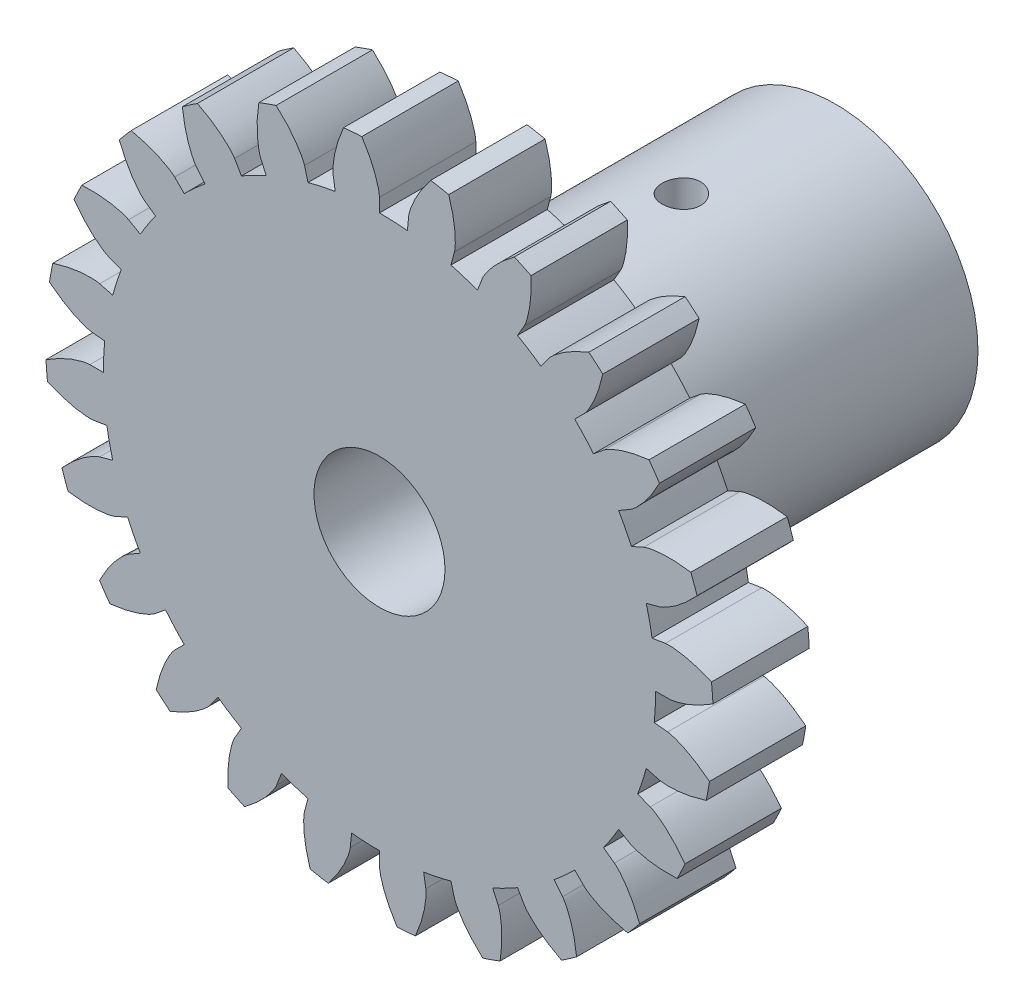
from build123d import *
from build123d.topology import SkipClean

# Parameters (mm, degrees)
SKETCH_3_R               = 26
EXTRUDE_2_DEPTH          = 7.5
CUT_EXTRUDE_2_DEPTH      = 38.526657192
PATTERN_CIRCULAR_1_COUNT = 24
MIRROR_1_COPY_1_DEPTH    = 38.526657192
MIRROR_1_COPY_2_DEPTH    = 38.526657192
MIRROR_1_COPY_3_DEPTH    = 38.526657192
MIRROR_1_COPY_4_DEPTH    = 38.526657192
MIRROR_1_COPY_5_DEPTH    = 38.526657192
MIRROR_1_COPY_6_DEPTH    = 38.526657192
MIRROR_1_COPY_7_DEPTH    = 38.526657192
MIRROR_1_COPY_8_DEPTH    = 38.526657192
MIRROR_1_COPY_9_DEPTH    = 38.526657192
MIRROR_1_COPY_10_DEPTH   = 38.526657192
MIRROR_1_COPY_11_DEPTH   = 38.526657192
MIRROR_1_COPY_12_DEPTH   = 38.526657192
MIRROR_1_COPY_13_DEPTH   = 38.526657192
MIRROR_1_COPY_14_DEPTH   = 38.526657192
MIRROR_1_COPY_15_DEPTH   = 38.526657192
MIRROR_1_COPY_16_DEPTH   = 38.526657192
MIRROR_1_COPY_17_DEPTH   = 38.526657192
MIRROR_1_COPY_18_DEPTH   = 38.526657192
MIRROR_1_COPY_19_DEPTH   = 38.526657192
MIRROR_1_COPY_20_DEPTH   = 38.526657192
MIRROR_1_COPY_21_DEPTH   = 38.526657192
MIRROR_1_COPY_22_DEPTH   = 38.526657192
MIRROR_1_COPY_23_DEPTH   = 38.526657192
MIRROR_1_COPY_24_DEPTH   = 38.526657192
SKETCH_5_R               = 5.1
CUT_EXTRUDE_3_DEPTH      = 38.476388038
SKETCH_7_R               = 11.1
SKETCH_7_R_2             = 5.1
EXTRUDE_3_DEPTH          = 28
CUT_EXTRUDE_4_DEPTH      = 47.176072363
CUT_EXTRUDE_4_DEPTH_BACK = 47.176072363
SKETCH_8_R               = 1.5


with BuildPart() as part:
    # ｽｹｯﾁ3 → ﾎﾞｽ - 押し出し2 (new body)
    with BuildSketch(Plane.XY):
        Circle(SKETCH_3_R)
    extrude(amount=EXTRUDE_2_DEPTH)

    # ｽｹｯﾁ4 → ｶｯﾄ - 押し出し2 (cut, through all)
    with BuildSketch(Plane.XY):
        with BuildLine():
            Line((21.472541613, -1.086258116), (25.966794508, -1.313614466))
            ThreePointArc((25.966794508, -1.313614466), (25.99998299, 0.029741003), (25.963721309, 1.373017029))
            add(Edge.make_bspline(
                [(22.552622899, 0), (22.58737922, 0.001108669), (22.656749084, 0.005403897), (22.850516265, 0.028314483), (23.215577821, 0.099947013), (23.763996392, 0.257632086), (24.493326716, 0.545763948), (25.148201555, 0.876714847), (25.627692166, 1.158881091), (25.900535651, 1.332190349), (25.963721309, 1.373017029)],
                knots=[0, 0, 0, 0, 0, 0.002802036, 0.005604071, 0.015718253, 0.029959921, 0.048733673, 0.068727069, 0.074791923, 0.074791923, 0.074791923, 0.074791923, 0.074791923], degree=4))
            Line((22.552622899, 0), (21.5, 0))
            ThreePointArc((21.5, 0), (21.493134307, -0.543302553), (21.472541613, -1.086258116))
        make_face()
    cut_extrude_2 = extrude(amount=CUT_EXTRUDE_2_DEPTH, mode=Mode.SUBTRACT)

    # 円形ﾊﾟﾀｰﾝ1: ｶｯﾄ - 押し出し2 ×24 about axis
    pattern_circular_1_axis = Axis((0, 0, 7.5), (0, 0, -1))
    for i in range(1, PATTERN_CIRCULAR_1_COUNT):
        add(cut_extrude_2.rotate(pattern_circular_1_axis, i * 360 / PATTERN_CIRCULAR_1_COUNT), mode=Mode.SUBTRACT)

    # ﾐﾗｰ1 copy 1 sketch → ﾐﾗｰ1 copy 1 (cut, through all)
    with BuildSketch(Plane(origin=(0, 0, 0), x_dir=(0.9871140654944314, 0.1600181917878578, 0), z_dir=(0, 0, 1))):
        with BuildLine():
            Line((21.472541613, 1.086258116), (25.966794508, 1.313614466))
            ThreePointArc((25.966794508, 1.313614466), (25.99998299, -0.029741003), (25.963721309, -1.373017029))
            add(Edge.make_bspline(
                [(22.552622899, 0), (22.58737922, -0.001108669), (22.656749084, -0.005403897), (22.850516265, -0.028314483), (23.215577821, -0.099947013), (23.763996392, -0.257632086), (24.493326716, -0.545763948), (25.148201555, -0.876714847), (25.627692166, -1.158881091), (25.900535651, -1.332190349), (25.963721309, -1.373017029)],
                knots=[0, 0, 0, 0, 0, 0.002802036, 0.005604071, 0.015718253, 0.029959921, 0.048733673, 0.068727069, 0.074791923, 0.074791923, 0.074791923, 0.074791923, 0.074791923], degree=4))
            Line((22.552622899, 0), (21.5, 0))
            ThreePointArc((21.5, 0), (21.493134307, 0.543302553), (21.472541613, 1.086258116))
        make_face()
    extrude(amount=MIRROR_1_COPY_1_DEPTH, mode=Mode.SUBTRACT)

    # ﾐﾗｰ1 copy 2 sketch → ﾐﾗｰ1 copy 2 (cut, through all)
    with BuildSketch(Plane(origin=(0, 0, 0), x_dir=(0.9120632137567047, 0.41004962396250505, 0), z_dir=(0, 0, 1))):
        with BuildLine():
            Line((21.472541613, 1.086258116), (25.966794508, 1.313614466))
            ThreePointArc((25.966794508, 1.313614466), (25.99998299, -0.029741003), (25.963721309, -1.373017029))
            add(Edge.make_bspline(
                [(22.552622899, 0), (22.58737922, -0.001108669), (22.656749084, -0.005403897), (22.850516265, -0.028314483), (23.215577821, -0.099947013), (23.763996392, -0.257632086), (24.493326716, -0.545763948), (25.148201555, -0.876714847), (25.627692166, -1.158881091), (25.900535651, -1.332190349), (25.963721309, -1.373017029)],
                knots=[0, 0, 0, 0, 0, 0.002802036, 0.005604071, 0.015718253, 0.029959921, 0.048733673, 0.068727069, 0.074791923, 0.074791923, 0.074791923, 0.074791923, 0.074791923], degree=4))
            Line((22.552622899, 0), (21.5, 0))
            ThreePointArc((21.5, 0), (21.493134307, 0.543302553), (21.472541613, 1.086258116))
        make_face()
    extrude(amount=MIRROR_1_COPY_2_DEPTH, mode=Mode.SUBTRACT)

    # ﾐﾗｰ1 copy 3 sketch → ﾐﾗｰ1 copy 3 (cut, through all)
    with BuildSketch(Plane(origin=(0, 0, 0), x_dir=(0.7748567612571848, 0.6321368519031512, 0), z_dir=(0, 0, 1))):
        with BuildLine():
            Line((21.472541613, 1.086258116), (25.966794508, 1.313614466))
            ThreePointArc((25.966794508, 1.313614466), (25.99998299, -0.029741003), (25.963721309, -1.373017029))
            add(Edge.make_bspline(
                [(22.552622899, 0), (22.58737922, -0.001108669), (22.656749084, -0.005403897), (22.850516265, -0.028314483), (23.215577821, -0.099947013), (23.763996392, -0.257632086), (24.493326716, -0.545763948), (25.148201555, -0.876714847), (25.627692166, -1.158881091), (25.900535651, -1.332190349), (25.963721309, -1.373017029)],
                knots=[0, 0, 0, 0, 0, 0.002802036, 0.005604071, 0.015718253, 0.029959921, 0.048733673, 0.068727069, 0.074791923, 0.074791923, 0.074791923, 0.074791923, 0.074791923], degree=4))
            Line((22.552622899, 0), (21.5, 0))
            ThreePointArc((21.5, 0), (21.493134307, 0.543302553), (21.472541613, 1.086258116))
        make_face()
    extrude(amount=MIRROR_1_COPY_3_DEPTH, mode=Mode.SUBTRACT)

    # ﾐﾗｰ1 copy 4 sketch → ﾐﾗｰ1 copy 4 (cut, through all)
    with BuildSketch(Plane(origin=(0, 0, 0), x_dir=(0.5848451009893306, 0.8111449980421381, 0), z_dir=(0, 0, 1))):
        with BuildLine():
            Line((21.472541613, 1.086258116), (25.966794508, 1.313614466))
            ThreePointArc((25.966794508, 1.313614466), (25.99998299, -0.029741003), (25.963721309, -1.373017029))
            add(Edge.make_bspline(
                [(22.552622899, 0), (22.58737922, -0.001108669), (22.656749084, -0.005403897), (22.850516265, -0.028314483), (23.215577821, -0.099947013), (23.763996392, -0.257632086), (24.493326716, -0.545763948), (25.148201555, -0.876714847), (25.627692166, -1.158881091), (25.900535651, -1.332190349), (25.963721309, -1.373017029)],
                knots=[0, 0, 0, 0, 0, 0.002802036, 0.005604071, 0.015718253, 0.029959921, 0.048733673, 0.068727069, 0.074791923, 0.074791923, 0.074791923, 0.074791923, 0.074791923], degree=4))
            Line((22.552622899, 0), (21.5, 0))
            ThreePointArc((21.5, 0), (21.493134307, 0.543302553), (21.472541613, 1.086258116))
        make_face()
    extrude(amount=MIRROR_1_COPY_4_DEPTH, mode=Mode.SUBTRACT)

    # ﾐﾗｰ1 copy 5 sketch → ﾐﾗｰ1 copy 5 (cut, through all)
    with BuildSketch(Plane(origin=(0, 0, 0), x_dir=(0.3549772135912804, 0.934874953045043, 0), z_dir=(0, 0, 1))):
        with BuildLine():
            Line((21.472541613, 1.086258116), (25.966794508, 1.313614466))
            ThreePointArc((25.966794508, 1.313614466), (25.99998299, -0.029741003), (25.963721309, -1.373017029))
            add(Edge.make_bspline(
                [(22.552622899, 0), (22.58737922, -0.001108669), (22.656749084, -0.005403897), (22.850516265, -0.028314483), (23.215577821, -0.099947013), (23.763996392, -0.257632086), (24.493326716, -0.545763948), (25.148201555, -0.876714847), (25.627692166, -1.158881091), (25.900535651, -1.332190349), (25.963721309, -1.373017029)],
                knots=[0, 0, 0, 0, 0, 0.002802036, 0.005604071, 0.015718253, 0.029959921, 0.048733673, 0.068727069, 0.074791923, 0.074791923, 0.074791923, 0.074791923, 0.074791923], degree=4))
            Line((22.552622899, 0), (21.5, 0))
            ThreePointArc((21.5, 0), (21.493134307, 0.543302553), (21.472541613, 1.086258116))
        make_face()
    extrude(amount=MIRROR_1_COPY_5_DEPTH, mode=Mode.SUBTRACT)

    # ﾐﾗｰ1 copy 6 sketch → ﾐﾗｰ1 copy 6 (cut, through all)
    with BuildSketch(Plane(origin=(0, 0, 0), x_dir=(0.10091821571456686, 0.9948947249518358, 0), z_dir=(0, 0, 1))):
        with BuildLine():
            Line((21.472541613, 1.086258116), (25.966794508, 1.313614466))
            ThreePointArc((25.966794508, 1.313614466), (25.99998299, -0.029741003), (25.963721309, -1.373017029))
            add(Edge.make_bspline(
                [(22.552622899, 0), (22.58737922, -0.001108669), (22.656749084, -0.005403897), (22.850516265, -0.028314483), (23.215577821, -0.099947013), (23.763996392, -0.257632086), (24.493326716, -0.545763948), (25.148201555, -0.876714847), (25.627692166, -1.158881091), (25.900535651, -1.332190349), (25.963721309, -1.373017029)],
                knots=[0, 0, 0, 0, 0, 0.002802036, 0.005604071, 0.015718253, 0.029959921, 0.048733673, 0.068727069, 0.074791923, 0.074791923, 0.074791923, 0.074791923, 0.074791923], degree=4))
            Line((22.552622899, 0), (21.5, 0))
            ThreePointArc((21.5, 0), (21.493134307, 0.543302553), (21.472541613, 1.086258116))
        make_face()
    extrude(amount=MIRROR_1_COPY_6_DEPTH, mode=Mode.SUBTRACT)

    # ﾐﾗｰ1 copy 7 sketch → ﾐﾗｰ1 copy 7 (cut, through all)
    with BuildSketch(Plane(origin=(0, 0, 0), x_dir=(-0.1600181917878578, 0.9871140654944318, 0), z_dir=(0, 0, 1))):
        with BuildLine():
            Line((21.472541613, 1.086258116), (25.966794508, 1.313614466))
            ThreePointArc((25.966794508, 1.313614466), (25.99998299, -0.029741003), (25.963721309, -1.373017029))
            add(Edge.make_bspline(
                [(22.552622899, 0), (22.58737922, -0.001108669), (22.656749084, -0.005403897), (22.850516265, -0.028314483), (23.215577821, -0.099947013), (23.763996392, -0.257632086), (24.493326716, -0.545763948), (25.148201555, -0.876714847), (25.627692166, -1.158881091), (25.900535651, -1.332190349), (25.963721309, -1.373017029)],
                knots=[0, 0, 0, 0, 0, 0.002802036, 0.005604071, 0.015718253, 0.029959921, 0.048733673, 0.068727069, 0.074791923, 0.074791923, 0.074791923, 0.074791923, 0.074791923], degree=4))
            Line((22.552622899, 0), (21.5, 0))
            ThreePointArc((21.5, 0), (21.493134307, 0.543302553), (21.472541613, 1.086258116))
        make_face()
    extrude(amount=MIRROR_1_COPY_7_DEPTH, mode=Mode.SUBTRACT)

    # ﾐﾗｰ1 copy 8 sketch → ﾐﾗｰ1 copy 8 (cut, through all)
    with BuildSketch(Plane(origin=(0, 0, 0), x_dir=(-0.41004962396250466, 0.9120632137567051, 0), z_dir=(0, 0, 1))):
        with BuildLine():
            Line((21.472541613, 1.086258116), (25.966794508, 1.313614466))
            ThreePointArc((25.966794508, 1.313614466), (25.99998299, -0.029741003), (25.963721309, -1.373017029))
            add(Edge.make_bspline(
                [(22.552622899, 0), (22.58737922, -0.001108669), (22.656749084, -0.005403897), (22.850516265, -0.028314483), (23.215577821, -0.099947013), (23.763996392, -0.257632086), (24.493326716, -0.545763948), (25.148201555, -0.876714847), (25.627692166, -1.158881091), (25.900535651, -1.332190349), (25.963721309, -1.373017029)],
                knots=[0, 0, 0, 0, 0, 0.002802036, 0.005604071, 0.015718253, 0.029959921, 0.048733673, 0.068727069, 0.074791923, 0.074791923, 0.074791923, 0.074791923, 0.074791923], degree=4))
            Line((22.552622899, 0), (21.5, 0))
            ThreePointArc((21.5, 0), (21.493134307, 0.543302553), (21.472541613, 1.086258116))
        make_face()
    extrude(amount=MIRROR_1_COPY_8_DEPTH, mode=Mode.SUBTRACT)

    # ﾐﾗｰ1 copy 9 sketch → ﾐﾗｰ1 copy 9 (cut, through all)
    with BuildSketch(Plane(origin=(0, 0, 0), x_dir=(-0.6321368519031508, 0.7748567612571852, 0), z_dir=(0, 0, 1))):
        with BuildLine():
            Line((21.472541613, 1.086258116), (25.966794508, 1.313614466))
            ThreePointArc((25.966794508, 1.313614466), (25.99998299, -0.029741003), (25.963721309, -1.373017029))
            add(Edge.make_bspline(
                [(22.552622899, 0), (22.58737922, -0.001108669), (22.656749084, -0.005403897), (22.850516265, -0.028314483), (23.215577821, -0.099947013), (23.763996392, -0.257632086), (24.493326716, -0.545763948), (25.148201555, -0.876714847), (25.627692166, -1.158881091), (25.900535651, -1.332190349), (25.963721309, -1.373017029)],
                knots=[0, 0, 0, 0, 0, 0.002802036, 0.005604071, 0.015718253, 0.029959921, 0.048733673, 0.068727069, 0.074791923, 0.074791923, 0.074791923, 0.074791923, 0.074791923], degree=4))
            Line((22.552622899, 0), (21.5, 0))
            ThreePointArc((21.5, 0), (21.493134307, 0.543302553), (21.472541613, 1.086258116))
        make_face()
    extrude(amount=MIRROR_1_COPY_9_DEPTH, mode=Mode.SUBTRACT)

    # ﾐﾗｰ1 copy 10 sketch → ﾐﾗｰ1 copy 10 (cut, through all)
    with BuildSketch(Plane(origin=(0, 0, 0), x_dir=(-0.811144998042138, 0.5848451009893306, 0), z_dir=(0, 0, 1))):
        with BuildLine():
            Line((21.472541613, 1.086258116), (25.966794508, 1.313614466))
            ThreePointArc((25.966794508, 1.313614466), (25.99998299, -0.029741003), (25.963721309, -1.373017029))
            add(Edge.make_bspline(
                [(22.552622899, 0), (22.58737922, -0.001108669), (22.656749084, -0.005403897), (22.850516265, -0.028314483), (23.215577821, -0.099947013), (23.763996392, -0.257632086), (24.493326716, -0.545763948), (25.148201555, -0.876714847), (25.627692166, -1.158881091), (25.900535651, -1.332190349), (25.963721309, -1.373017029)],
                knots=[0, 0, 0, 0, 0, 0.002802036, 0.005604071, 0.015718253, 0.029959921, 0.048733673, 0.068727069, 0.074791923, 0.074791923, 0.074791923, 0.074791923, 0.074791923], degree=4))
            Line((22.552622899, 0), (21.5, 0))
            ThreePointArc((21.5, 0), (21.493134307, 0.543302553), (21.472541613, 1.086258116))
        make_face()
    extrude(amount=MIRROR_1_COPY_10_DEPTH, mode=Mode.SUBTRACT)

    # ﾐﾗｰ1 copy 11 sketch → ﾐﾗｰ1 copy 11 (cut, through all)
    with BuildSketch(Plane(origin=(0, 0, 0), x_dir=(-0.9348749530450424, 0.3549772135912808, 0), z_dir=(0, 0, 1))):
        with BuildLine():
            Line((21.472541613, 1.086258116), (25.966794508, 1.313614466))
            ThreePointArc((25.966794508, 1.313614466), (25.99998299, -0.029741003), (25.963721309, -1.373017029))
            add(Edge.make_bspline(
                [(22.552622899, 0), (22.58737922, -0.001108669), (22.656749084, -0.005403897), (22.850516265, -0.028314483), (23.215577821, -0.099947013), (23.763996392, -0.257632086), (24.493326716, -0.545763948), (25.148201555, -0.876714847), (25.627692166, -1.158881091), (25.900535651, -1.332190349), (25.963721309, -1.373017029)],
                knots=[0, 0, 0, 0, 0, 0.002802036, 0.005604071, 0.015718253, 0.029959921, 0.048733673, 0.068727069, 0.074791923, 0.074791923, 0.074791923, 0.074791923, 0.074791923], degree=4))
            Line((22.552622899, 0), (21.5, 0))
            ThreePointArc((21.5, 0), (21.493134307, 0.543302553), (21.472541613, 1.086258116))
        make_face()
    extrude(amount=MIRROR_1_COPY_11_DEPTH, mode=Mode.SUBTRACT)

    # ﾐﾗｰ1 copy 12 sketch → ﾐﾗｰ1 copy 12 (cut, through all)
    with BuildSketch(Plane(origin=(0, 0, 0), x_dir=(-0.9948947249518354, 0.10091821571456693, 0), z_dir=(0, 0, 1))):
        with BuildLine():
            Line((21.472541613, 1.086258116), (25.966794508, 1.313614466))
            ThreePointArc((25.966794508, 1.313614466), (25.99998299, -0.029741003), (25.963721309, -1.373017029))
            add(Edge.make_bspline(
                [(22.552622899, 0), (22.58737922, -0.001108669), (22.656749084, -0.005403897), (22.850516265, -0.028314483), (23.215577821, -0.099947013), (23.763996392, -0.257632086), (24.493326716, -0.545763948), (25.148201555, -0.876714847), (25.627692166, -1.158881091), (25.900535651, -1.332190349), (25.963721309, -1.373017029)],
                knots=[0, 0, 0, 0, 0, 0.002802036, 0.005604071, 0.015718253, 0.029959921, 0.048733673, 0.068727069, 0.074791923, 0.074791923, 0.074791923, 0.074791923, 0.074791923], degree=4))
            Line((22.552622899, 0), (21.5, 0))
            ThreePointArc((21.5, 0), (21.493134307, 0.543302553), (21.472541613, 1.086258116))
        make_face()
    extrude(amount=MIRROR_1_COPY_12_DEPTH, mode=Mode.SUBTRACT)

    # ﾐﾗｰ1 copy 13 sketch → ﾐﾗｰ1 copy 13 (cut, through all)
    with BuildSketch(Plane(origin=(0, 0, 0), x_dir=(-0.9871140654944314, -0.16001819178785787, 0), z_dir=(0, 0, 1))):
        with BuildLine():
            Line((21.472541613, 1.086258116), (25.966794508, 1.313614466))
            ThreePointArc((25.966794508, 1.313614466), (25.99998299, -0.029741003), (25.963721309, -1.373017029))
            add(Edge.make_bspline(
                [(22.552622899, 0), (22.58737922, -0.001108669), (22.656749084, -0.005403897), (22.850516265, -0.028314483), (23.215577821, -0.099947013), (23.763996392, -0.257632086), (24.493326716, -0.545763948), (25.148201555, -0.876714847), (25.627692166, -1.158881091), (25.900535651, -1.332190349), (25.963721309, -1.373017029)],
                knots=[0, 0, 0, 0, 0, 0.002802036, 0.005604071, 0.015718253, 0.029959921, 0.048733673, 0.068727069, 0.074791923, 0.074791923, 0.074791923, 0.074791923, 0.074791923], degree=4))
            Line((22.552622899, 0), (21.5, 0))
            ThreePointArc((21.5, 0), (21.493134307, 0.543302553), (21.472541613, 1.086258116))
        make_face()
    extrude(amount=MIRROR_1_COPY_13_DEPTH, mode=Mode.SUBTRACT)

    # ﾐﾗｰ1 copy 14 sketch → ﾐﾗｰ1 copy 14 (cut, through all)
    with BuildSketch(Plane(origin=(0, 0, 0), x_dir=(-0.9120632137567046, -0.4100496239625052, 0), z_dir=(0, 0, 1))):
        with BuildLine():
            Line((21.472541613, 1.086258116), (25.966794508, 1.313614466))
            ThreePointArc((25.966794508, 1.313614466), (25.99998299, -0.029741003), (25.963721309, -1.373017029))
            add(Edge.make_bspline(
                [(22.552622899, 0), (22.58737922, -0.001108669), (22.656749084, -0.005403897), (22.850516265, -0.028314483), (23.215577821, -0.099947013), (23.763996392, -0.257632086), (24.493326716, -0.545763948), (25.148201555, -0.876714847), (25.627692166, -1.158881091), (25.900535651, -1.332190349), (25.963721309, -1.373017029)],
                knots=[0, 0, 0, 0, 0, 0.002802036, 0.005604071, 0.015718253, 0.029959921, 0.048733673, 0.068727069, 0.074791923, 0.074791923, 0.074791923, 0.074791923, 0.074791923], degree=4))
            Line((22.552622899, 0), (21.5, 0))
            ThreePointArc((21.5, 0), (21.493134307, 0.543302553), (21.472541613, 1.086258116))
        make_face()
    extrude(amount=MIRROR_1_COPY_14_DEPTH, mode=Mode.SUBTRACT)

    # ﾐﾗｰ1 copy 15 sketch → ﾐﾗｰ1 copy 15 (cut, through all)
    with BuildSketch(Plane(origin=(0, 0, 0), x_dir=(-0.774856761257185, -0.6321368519031512, 0), z_dir=(0, 0, 1))):
        with BuildLine():
            Line((21.472541613, 1.086258116), (25.966794508, 1.313614466))
            ThreePointArc((25.966794508, 1.313614466), (25.99998299, -0.029741003), (25.963721309, -1.373017029))
            add(Edge.make_bspline(
                [(22.552622899, 0), (22.58737922, -0.001108669), (22.656749084, -0.005403897), (22.850516265, -0.028314483), (23.215577821, -0.099947013), (23.763996392, -0.257632086), (24.493326716, -0.545763948), (25.148201555, -0.876714847), (25.627692166, -1.158881091), (25.900535651, -1.332190349), (25.963721309, -1.373017029)],
                knots=[0, 0, 0, 0, 0, 0.002802036, 0.005604071, 0.015718253, 0.029959921, 0.048733673, 0.068727069, 0.074791923, 0.074791923, 0.074791923, 0.074791923, 0.074791923], degree=4))
            Line((22.552622899, 0), (21.5, 0))
            ThreePointArc((21.5, 0), (21.493134307, 0.543302553), (21.472541613, 1.086258116))
        make_face()
    extrude(amount=MIRROR_1_COPY_15_DEPTH, mode=Mode.SUBTRACT)

    # ﾐﾗｰ1 copy 16 sketch → ﾐﾗｰ1 copy 16 (cut, through all)
    with BuildSketch(Plane(origin=(0, 0, 0), x_dir=(-0.584845100989331, -0.8111449980421379, 0), z_dir=(0, 0, 1))):
        with BuildLine():
            Line((21.472541613, 1.086258116), (25.966794508, 1.313614466))
            ThreePointArc((25.966794508, 1.313614466), (25.99998299, -0.029741003), (25.963721309, -1.373017029))
            add(Edge.make_bspline(
                [(22.552622899, 0), (22.58737922, -0.001108669), (22.656749084, -0.005403897), (22.850516265, -0.028314483), (23.215577821, -0.099947013), (23.763996392, -0.257632086), (24.493326716, -0.545763948), (25.148201555, -0.876714847), (25.627692166, -1.158881091), (25.900535651, -1.332190349), (25.963721309, -1.373017029)],
                knots=[0, 0, 0, 0, 0, 0.002802036, 0.005604071, 0.015718253, 0.029959921, 0.048733673, 0.068727069, 0.074791923, 0.074791923, 0.074791923, 0.074791923, 0.074791923], degree=4))
            Line((22.552622899, 0), (21.5, 0))
            ThreePointArc((21.5, 0), (21.493134307, 0.543302553), (21.472541613, 1.086258116))
        make_face()
    extrude(amount=MIRROR_1_COPY_16_DEPTH, mode=Mode.SUBTRACT)

    # ﾐﾗｰ1 copy 17 sketch → ﾐﾗｰ1 copy 17 (cut, through all)
    with BuildSketch(Plane(origin=(0, 0, 0), x_dir=(-0.3549772135912803, -0.934874953045043, 0), z_dir=(0, 0, 1))):
        with BuildLine():
            Line((21.472541613, 1.086258116), (25.966794508, 1.313614466))
            ThreePointArc((25.966794508, 1.313614466), (25.99998299, -0.029741003), (25.963721309, -1.373017029))
            add(Edge.make_bspline(
                [(22.552622899, 0), (22.58737922, -0.001108669), (22.656749084, -0.005403897), (22.850516265, -0.028314483), (23.215577821, -0.099947013), (23.763996392, -0.257632086), (24.493326716, -0.545763948), (25.148201555, -0.876714847), (25.627692166, -1.158881091), (25.900535651, -1.332190349), (25.963721309, -1.373017029)],
                knots=[0, 0, 0, 0, 0, 0.002802036, 0.005604071, 0.015718253, 0.029959921, 0.048733673, 0.068727069, 0.074791923, 0.074791923, 0.074791923, 0.074791923, 0.074791923], degree=4))
            Line((22.552622899, 0), (21.5, 0))
            ThreePointArc((21.5, 0), (21.493134307, 0.543302553), (21.472541613, 1.086258116))
        make_face()
    extrude(amount=MIRROR_1_COPY_17_DEPTH, mode=Mode.SUBTRACT)

    # ﾐﾗｰ1 copy 18 sketch → ﾐﾗｰ1 copy 18 (cut, through all)
    with BuildSketch(Plane(origin=(0, 0, 0), x_dir=(-0.10091821571456698, -0.9948947249518358, 0), z_dir=(0, 0, 1))):
        with BuildLine():
            Line((21.472541613, 1.086258116), (25.966794508, 1.313614466))
            ThreePointArc((25.966794508, 1.313614466), (25.99998299, -0.029741003), (25.963721309, -1.373017029))
            add(Edge.make_bspline(
                [(22.552622899, 0), (22.58737922, -0.001108669), (22.656749084, -0.005403897), (22.850516265, -0.028314483), (23.215577821, -0.099947013), (23.763996392, -0.257632086), (24.493326716, -0.545763948), (25.148201555, -0.876714847), (25.627692166, -1.158881091), (25.900535651, -1.332190349), (25.963721309, -1.373017029)],
                knots=[0, 0, 0, 0, 0, 0.002802036, 0.005604071, 0.015718253, 0.029959921, 0.048733673, 0.068727069, 0.074791923, 0.074791923, 0.074791923, 0.074791923, 0.074791923], degree=4))
            Line((22.552622899, 0), (21.5, 0))
            ThreePointArc((21.5, 0), (21.493134307, 0.543302553), (21.472541613, 1.086258116))
        make_face()
    extrude(amount=MIRROR_1_COPY_18_DEPTH, mode=Mode.SUBTRACT)

    # ﾐﾗｰ1 copy 19 sketch → ﾐﾗｰ1 copy 19 (cut, through all)
    with BuildSketch(Plane(origin=(0, 0, 0), x_dir=(0.16001819178785723, -0.9871140654944318, 0), z_dir=(0, 0, 1))):
        with BuildLine():
            Line((21.472541613, 1.086258116), (25.966794508, 1.313614466))
            ThreePointArc((25.966794508, 1.313614466), (25.99998299, -0.029741003), (25.963721309, -1.373017029))
            add(Edge.make_bspline(
                [(22.552622899, 0), (22.58737922, -0.001108669), (22.656749084, -0.005403897), (22.850516265, -0.028314483), (23.215577821, -0.099947013), (23.763996392, -0.257632086), (24.493326716, -0.545763948), (25.148201555, -0.876714847), (25.627692166, -1.158881091), (25.900535651, -1.332190349), (25.963721309, -1.373017029)],
                knots=[0, 0, 0, 0, 0, 0.002802036, 0.005604071, 0.015718253, 0.029959921, 0.048733673, 0.068727069, 0.074791923, 0.074791923, 0.074791923, 0.074791923, 0.074791923], degree=4))
            Line((22.552622899, 0), (21.5, 0))
            ThreePointArc((21.5, 0), (21.493134307, 0.543302553), (21.472541613, 1.086258116))
        make_face()
    extrude(amount=MIRROR_1_COPY_19_DEPTH, mode=Mode.SUBTRACT)

    # ﾐﾗｰ1 copy 20 sketch → ﾐﾗｰ1 copy 20 (cut, through all)
    with BuildSketch(Plane(origin=(0, 0, 0), x_dir=(0.410049623962505, -0.9120632137567051, 0), z_dir=(0, 0, 1))):
        with BuildLine():
            Line((21.472541613, 1.086258116), (25.966794508, 1.313614466))
            ThreePointArc((25.966794508, 1.313614466), (25.99998299, -0.029741003), (25.963721309, -1.373017029))
            add(Edge.make_bspline(
                [(22.552622899, 0), (22.58737922, -0.001108669), (22.656749084, -0.005403897), (22.850516265, -0.028314483), (23.215577821, -0.099947013), (23.763996392, -0.257632086), (24.493326716, -0.545763948), (25.148201555, -0.876714847), (25.627692166, -1.158881091), (25.900535651, -1.332190349), (25.963721309, -1.373017029)],
                knots=[0, 0, 0, 0, 0, 0.002802036, 0.005604071, 0.015718253, 0.029959921, 0.048733673, 0.068727069, 0.074791923, 0.074791923, 0.074791923, 0.074791923, 0.074791923], degree=4))
            Line((22.552622899, 0), (21.5, 0))
            ThreePointArc((21.5, 0), (21.493134307, 0.543302553), (21.472541613, 1.086258116))
        make_face()
    extrude(amount=MIRROR_1_COPY_20_DEPTH, mode=Mode.SUBTRACT)

    # ﾐﾗｰ1 copy 21 sketch → ﾐﾗｰ1 copy 21 (cut, through all)
    with BuildSketch(Plane(origin=(0, 0, 0), x_dir=(0.6321368519031507, -0.7748567612571853, 0), z_dir=(0, 0, 1))):
        with BuildLine():
            Line((21.472541613, 1.086258116), (25.966794508, 1.313614466))
            ThreePointArc((25.966794508, 1.313614466), (25.99998299, -0.029741003), (25.963721309, -1.373017029))
            add(Edge.make_bspline(
                [(22.552622899, 0), (22.58737922, -0.001108669), (22.656749084, -0.005403897), (22.850516265, -0.028314483), (23.215577821, -0.099947013), (23.763996392, -0.257632086), (24.493326716, -0.545763948), (25.148201555, -0.876714847), (25.627692166, -1.158881091), (25.900535651, -1.332190349), (25.963721309, -1.373017029)],
                knots=[0, 0, 0, 0, 0, 0.002802036, 0.005604071, 0.015718253, 0.029959921, 0.048733673, 0.068727069, 0.074791923, 0.074791923, 0.074791923, 0.074791923, 0.074791923], degree=4))
            Line((22.552622899, 0), (21.5, 0))
            ThreePointArc((21.5, 0), (21.493134307, 0.543302553), (21.472541613, 1.086258116))
        make_face()
    extrude(amount=MIRROR_1_COPY_21_DEPTH, mode=Mode.SUBTRACT)

    # ﾐﾗｰ1 copy 22 sketch → ﾐﾗｰ1 copy 22 (cut, through all)
    with BuildSketch(Plane(origin=(0, 0, 0), x_dir=(0.8111449980421376, -0.5848451009893312, 0), z_dir=(0, 0, 1))):
        with BuildLine():
            Line((21.472541613, 1.086258116), (25.966794508, 1.313614466))
            ThreePointArc((25.966794508, 1.313614466), (25.99998299, -0.029741003), (25.963721309, -1.373017029))
            add(Edge.make_bspline(
                [(22.552622899, 0), (22.58737922, -0.001108669), (22.656749084, -0.005403897), (22.850516265, -0.028314483), (23.215577821, -0.099947013), (23.763996392, -0.257632086), (24.493326716, -0.545763948), (25.148201555, -0.876714847), (25.627692166, -1.158881091), (25.900535651, -1.332190349), (25.963721309, -1.373017029)],
                knots=[0, 0, 0, 0, 0, 0.002802036, 0.005604071, 0.015718253, 0.029959921, 0.048733673, 0.068727069, 0.074791923, 0.074791923, 0.074791923, 0.074791923, 0.074791923], degree=4))
            Line((22.552622899, 0), (21.5, 0))
            ThreePointArc((21.5, 0), (21.493134307, 0.543302553), (21.472541613, 1.086258116))
        make_face()
    extrude(amount=MIRROR_1_COPY_22_DEPTH, mode=Mode.SUBTRACT)

    # ﾐﾗｰ1 copy 23 sketch → ﾐﾗｰ1 copy 23 (cut, through all)
    with BuildSketch(Plane(origin=(0, 0, 0), x_dir=(0.9348749530450425, -0.3549772135912805, 0), z_dir=(0, 0, 1))):
        with BuildLine():
            Line((21.472541613, 1.086258116), (25.966794508, 1.313614466))
            ThreePointArc((25.966794508, 1.313614466), (25.99998299, -0.029741003), (25.963721309, -1.373017029))
            add(Edge.make_bspline(
                [(22.552622899, 0), (22.58737922, -0.001108669), (22.656749084, -0.005403897), (22.850516265, -0.028314483), (23.215577821, -0.099947013), (23.763996392, -0.257632086), (24.493326716, -0.545763948), (25.148201555, -0.876714847), (25.627692166, -1.158881091), (25.900535651, -1.332190349), (25.963721309, -1.373017029)],
                knots=[0, 0, 0, 0, 0, 0.002802036, 0.005604071, 0.015718253, 0.029959921, 0.048733673, 0.068727069, 0.074791923, 0.074791923, 0.074791923, 0.074791923, 0.074791923], degree=4))
            Line((22.552622899, 0), (21.5, 0))
            ThreePointArc((21.5, 0), (21.493134307, 0.543302553), (21.472541613, 1.086258116))
        make_face()
    extrude(amount=MIRROR_1_COPY_23_DEPTH, mode=Mode.SUBTRACT)

    # ﾐﾗｰ1 copy 24 sketch → ﾐﾗｰ1 copy 24 (cut, through all)
    with BuildSketch(Plane(origin=(0, 0, 0), x_dir=(0.9948947249518354, -0.1009182157145668, 0), z_dir=(0, 0, 1))):
        with BuildLine():
            Line((21.472541613, 1.086258116), (25.966794508, 1.313614466))
            ThreePointArc((25.966794508, 1.313614466), (25.99998299, -0.029741003), (25.963721309, -1.373017029))
            add(Edge.make_bspline(
                [(22.552622899, 0), (22.58737922, -0.001108669), (22.656749084, -0.005403897), (22.850516265, -0.028314483), (23.215577821, -0.099947013), (23.763996392, -0.257632086), (24.493326716, -0.545763948), (25.148201555, -0.876714847), (25.627692166, -1.158881091), (25.900535651, -1.332190349), (25.963721309, -1.373017029)],
                knots=[0, 0, 0, 0, 0, 0.002802036, 0.005604071, 0.015718253, 0.029959921, 0.048733673, 0.068727069, 0.074791923, 0.074791923, 0.074791923, 0.074791923, 0.074791923], degree=4))
            Line((22.552622899, 0), (21.5, 0))
            ThreePointArc((21.5, 0), (21.493134307, 0.543302553), (21.472541613, 1.086258116))
        make_face()
    extrude(amount=MIRROR_1_COPY_24_DEPTH, mode=Mode.SUBTRACT)

    # ｽｹｯﾁ5 → ｶｯﾄ - 押し出し3 (cut, through all)
    with BuildSketch(Plane.XY.offset(7.5)):
        Circle(SKETCH_5_R)
    extrude(amount=-CUT_EXTRUDE_3_DEPTH, mode=Mode.SUBTRACT)

    # ｽｹｯﾁ7 → ﾎﾞｽ - 押し出し3 (add)
    with SkipClean():  # the faces are left unmerged after this step: merging them gives an invalid solid
        with BuildSketch(Plane(origin=(0, 0, 0), x_dir=(-1, 0, 0), z_dir=(0, 0, -1))):
            Circle(SKETCH_7_R)
            Circle(SKETCH_7_R_2, mode=Mode.SUBTRACT)
        extrude(amount=EXTRUDE_3_DEPTH)

    # ｽｹｯﾁ8 → ｶｯﾄ - 押し出し4 (cut, two sides: drawn at the far end of the back side and taken through both)
    with SkipClean():  # the faces are left unmerged after this step: merging them gives an invalid solid
        with BuildSketch(Plane(origin=(0, 0, 0), x_dir=(1, 0, 0), z_dir=(0, 1, 0)).offset(-CUT_EXTRUDE_4_DEPTH_BACK)):
            with Locations((0, 16)):
                Circle(SKETCH_8_R)
        extrude(amount=CUT_EXTRUDE_4_DEPTH + CUT_EXTRUDE_4_DEPTH_BACK, mode=Mode.SUBTRACT)


solid = part.part
